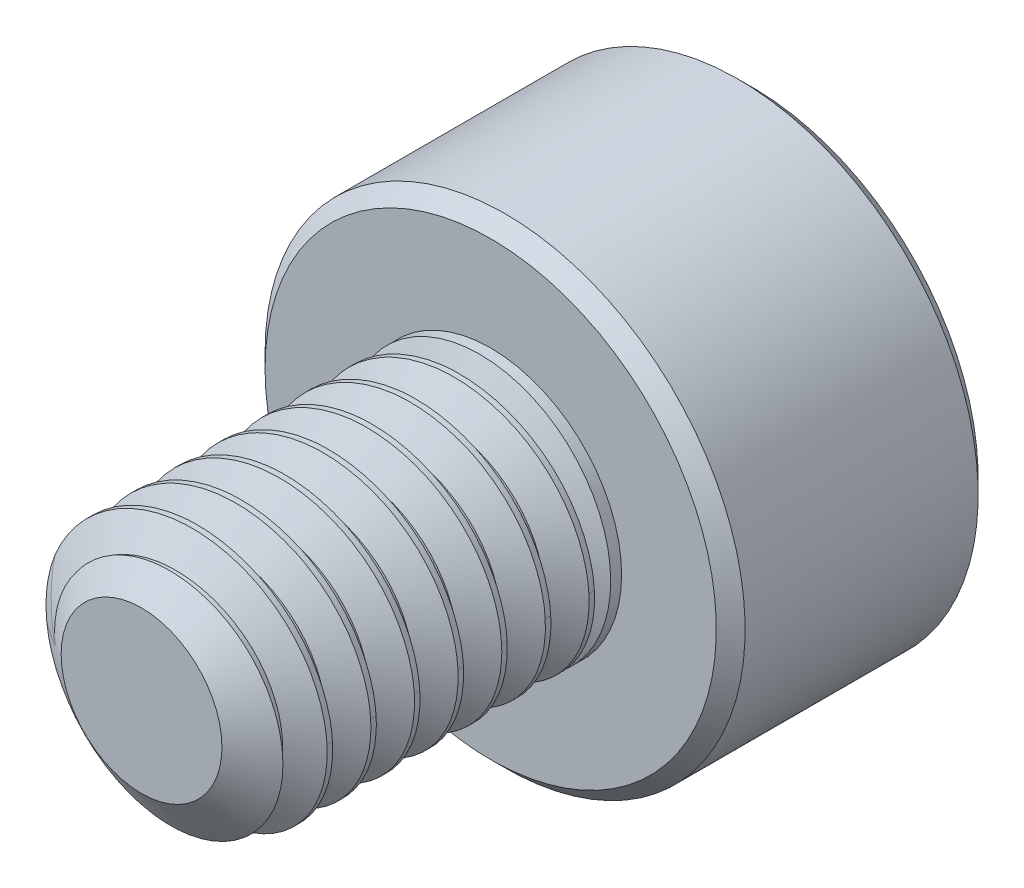
from build123d import *

# Parameters (mm, degrees)
SKETCH1_R          = 1.5
EXTRUDE1_DEPTH     = 4
CUT_SWEEP1_PITCH   = 0.5
SKETCH6_R          = 2.75
EXTRUDE2_DEPTH     = 3
CUT_EXTRUDE1_DEPTH = 1.875
CHAMFER1_SIZE      = 0.165


with BuildPart() as part:
    # Sketch1 → Extrude1 (new body)
    with BuildSketch(Plane.XY):
        Circle(SKETCH1_R)
    extrude(amount=-EXTRUDE1_DEPTH)

    # Cut-Sweep1: the profile of Sketch3 profile screwed along a right-hand helix of 9 turns, 6 arcs to a turn; built about Z, then put on its axis
    cut_sweep1_z = Axis((0, 0, 0), (0, 0, 1))
    cut_sweep1_corners = [(1.5003, 0, -0.437673205), (1.175240474, 0, -0.25), (1.175240474, 0, -0.1875), (1.5003, 0, 0.000173205)]
    with BuildLine(mode=Mode.PRIVATE) as cut_sweep1_profile:
        Line(cut_sweep1_corners[0], cut_sweep1_corners[1])
        Line(cut_sweep1_corners[1], cut_sweep1_corners[2])
        Line(cut_sweep1_corners[2], cut_sweep1_corners[3])
        Line(cut_sweep1_corners[3], cut_sweep1_corners[0])
    cut_sweep1_cap = Face(cut_sweep1_profile.wire())
    cut_sweep1_turn_angles = [0, 30, 60, 90, 120, 150, 180, 210, 240, 270, 300, 330, 360]
    cut_sweep1_turn_weights = [1, 0.8660254037844387, 1, 0.8660254037844387, 1, 0.8660254037844387, 1, 0.8660254037844387, 1, 0.8660254037844387, 1, 0.8660254037844387, 1]
    cut_sweep1_turn_rails = [Edge.make_bspline([Vector(p[0], p[1], 0).rotate(cut_sweep1_z, cut_sweep1_turn_angles[k]) / cut_sweep1_turn_weights[k] + Vector(0, 0, p[2] + CUT_SWEEP1_PITCH * cut_sweep1_turn_angles[k] / 360) for k in range(13)], [0, 0, 0, 1, 1, 2, 2, 3, 3, 4, 4, 5, 5, 6, 6, 6], 2, cut_sweep1_turn_weights) for p in cut_sweep1_corners]
    cut_sweep1_turn_sides = [Face.make_surface_from_curves(cut_sweep1_turn_rails[p[0]], cut_sweep1_turn_rails[p[1]]) for p in [(0, 1), (1, 2), (2, 3), (3, 0)]]
    cut_sweep1 = Plane(origin=(0, 0, 0), x_dir=(0, 1, 0), z_dir=(0, 0, -1)) * Solid(Shell([*[p.moved(Location((0, 0, CUT_SWEEP1_PITCH * i))) for i in range(9) for p in cut_sweep1_turn_sides], cut_sweep1_cap, cut_sweep1_cap.rotate(cut_sweep1_z, 3240).moved(Location((0, 0, CUT_SWEEP1_PITCH * 3240 / 360)))]))
    add(cut_sweep1, mode=Mode.SUBTRACT)

    # Sketch4 → Cut-Revolve1 (revolve, cut)
    with BuildSketch(Plane(origin=(0, 0, 0), x_dir=(0, 0, -1), z_dir=(1, 0, 0)), mode=Mode.PRIVATE) as cut_revolve1_sk:
        Polygon((0.405251783, 1.5), (0, 0.921240474), (0, 1.5), align=None)
    revolve(cut_revolve1_sk.sketch.rotate(Axis((0, 0, 0), (0, 0, -1)), 263.352109169), axis=Axis((0, 0, 0), (0, 0, -1)), mode=Mode.SUBTRACT)

    # Sketch6 → Extrude2 (add)
    with BuildSketch(Plane(origin=(0, 0, -4), x_dir=(-1, 0, 0), z_dir=(0, 0, -1))):
        Circle(SKETCH6_R)
    extrude(amount=EXTRUDE2_DEPTH)

    # Sketch7 → Cut-Extrude1 (cut)
    with BuildSketch(Plane(origin=(0, 0, -7), x_dir=(-1, 0, 0), z_dir=(0, 0, -1))):
        Polygon((0, 1.443375673), (-1.25, 0.721687836), (-1.25, -0.721687836), (0, -1.443375673), (1.25, -0.721687836), (1.25, 0.721687836), align=None)
    extrude(amount=-CUT_EXTRUDE1_DEPTH, mode=Mode.SUBTRACT)

    # Cut-Extrude2 cone 1 section (through the dimple's axis) → Cut-Extrude2 (revolve, cut)
    with BuildSketch(Plane(origin=(0, 0, -7), x_dir=(0, 1, 0), z_dir=(1, 0, 0))):
        Polygon((0, 0), (1.443375673, 0), (0, 1.443375673), align=None)
    revolve(axis=Axis((0, 0, -7), (0, 0, 1)), mode=Mode.SUBTRACT)

    # Chamfer1
    chamfer1_edges = [part.edges().sort_by_distance(p)[0] for p in [
        (2.75, 0, -4),
        (2.75, 0, -7),
    ]]
    chamfer(chamfer1_edges, length=CHAMFER1_SIZE)

    # Sketch10 → Revolve1 (revolve)
    with BuildSketch(Plane(origin=(0, 0, 0), x_dir=(0, 0, -1), z_dir=(1, 0, 0)), mode=Mode.PRIVATE) as revolve1_sk:
        Polygon((4, 1.5), (4, 0), (3.253679656, 0), (3.875, 1.5), align=None)
    revolve(revolve1_sk.sketch.rotate(Axis((0, 0, -4), (0, 0, 1)), 270), axis=Axis((0, 0, -4), (0, 0, 1)))


solid = part.part
